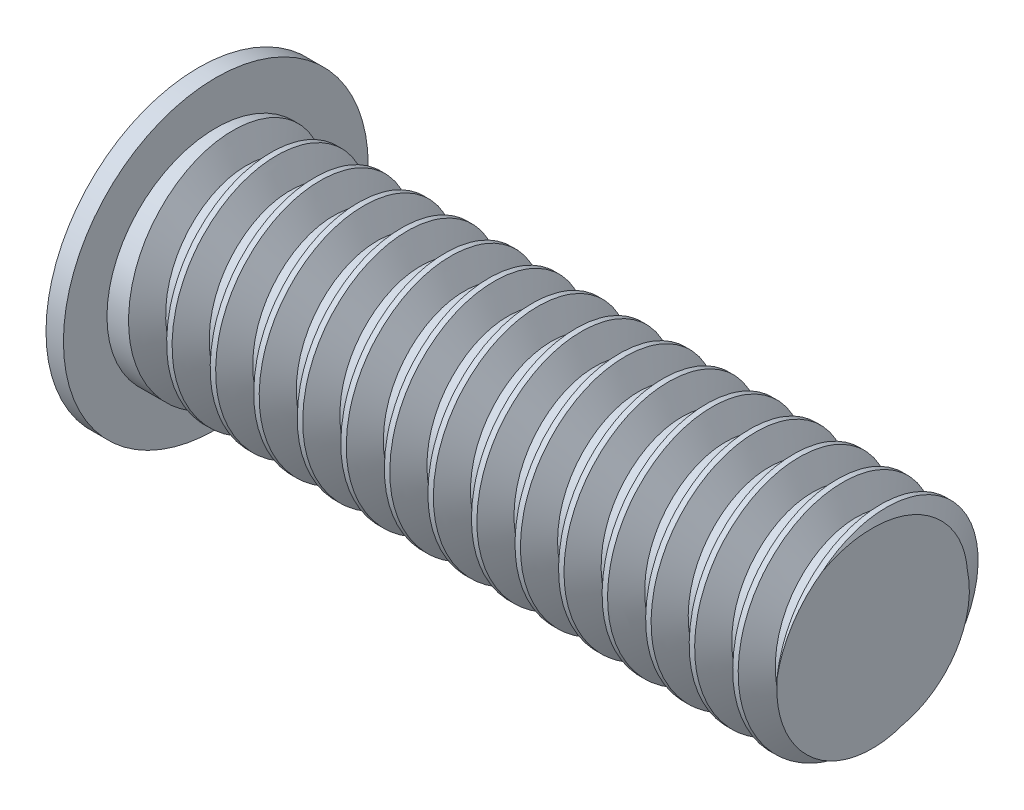
from build123d import *

# Parameters (mm, degrees)
SKETCH2_W          = 6.15375985
SKETCH2_H          = 0.730872065
CUT_EXTRUDE1_DEPTH = 0.254
THREAD1_PITCH      = 1.27


with BuildPart() as part:
    # Sketch1 → Revolve1 (revolve)
    with BuildSketch(Plane(origin=(0, 0, 0), x_dir=(1, 0, 0), z_dir=(0, 1, 0)), mode=Mode.PRIVATE) as revolve1_sk:
        Polygon((0, 0), (-19.490008539, 0), (-19.490008539, -1.27), (-19.998008539, -1.27), (-19.998008539, 3.175), (-19.490008539, 3.175), (0, 3.175), align=None)
    revolve(revolve1_sk.sketch.rotate(Axis((0, 0, -3.175), (-1, 0, 0)), 180), axis=Axis((0, 0, -3.175), (-1, 0, 0)))

    # Sketch2 → Cut-Extrude1 (cut)
    with BuildSketch(Plane.ZY.offset(19.998008539)):
        with Locations((-3.076879925, -0.012747769)):
            Rectangle(SKETCH2_W, SKETCH2_H)
    extrude(amount=-CUT_EXTRUDE1_DEPTH, mode=Mode.SUBTRACT)

    # Thread1: the profile of Thread Profile1 profile screwed along a right-hand helix of 15.874016 turns, 8 arcs to a turn; built about Z, then put on its axis
    thread1_z = Axis((0, 0, 0), (0, 0, 1))
    thread1_corners = [(3.1753, 0, -0.000173205), (3.1753, 0, 1.111423202), (2.487592339, 0, 0.714374999), (2.487592339, 0, 0.396874999)]
    with BuildLine(mode=Mode.PRIVATE) as thread1_profile:
        Line(thread1_corners[0], thread1_corners[1])
        Line(thread1_corners[1], thread1_corners[2])
        Line(thread1_corners[2], thread1_corners[3])
        Line(thread1_corners[3], thread1_corners[0])
    thread1_cap = Face(thread1_profile.wire())
    thread1_turn_angles = [0, 22.5, 45, 67.5, 90, 112.5, 135, 157.5, 180, 202.5, 225, 247.5, 270, 292.5, 315, 337.5, 360]
    thread1_turn_weights = [1, 0.9238795325112867, 1, 0.9238795325112867, 1, 0.9238795325112867, 1, 0.9238795325112867, 1, 0.9238795325112867, 1, 0.9238795325112867, 1, 0.9238795325112867, 1, 0.9238795325112867, 1]
    thread1_turn_rails = [Edge.make_bspline([Vector(p[0], p[1], 0).rotate(thread1_z, thread1_turn_angles[k]) / thread1_turn_weights[k] + Vector(0, 0, p[2] + THREAD1_PITCH * thread1_turn_angles[k] / 360) for k in range(17)], [0, 0, 0, 1, 1, 2, 2, 3, 3, 4, 4, 5, 5, 6, 6, 7, 7, 8, 8, 8], 2, thread1_turn_weights) for p in thread1_corners]
    thread1_turn_sides = [Face.make_surface_from_curves(thread1_turn_rails[p[0]], thread1_turn_rails[p[1]]) for p in [(0, 1), (1, 2), (2, 3), (3, 0)]]
    thread1_last_angles = [5400, 5422.5, 5445, 5467.5, 5490, 5512.5, 5535, 5557.5, 5580, 5602.5, 5625, 5647.5, 5670, 5692.322834646, 5714.645669291]
    thread1_last_weights = [1, 0.9238795325112867, 1, 0.9238795325112867, 1, 0.9238795325112867, 1, 0.9238795325112867, 1, 0.9238795325112867, 1, 0.9238795325112867, 1, 0.9250584165493089, 1]
    thread1_last_rails = [Edge.make_bspline([Vector(p[0], p[1], 0).rotate(thread1_z, thread1_last_angles[k]) / thread1_last_weights[k] + Vector(0, 0, p[2] + THREAD1_PITCH * thread1_last_angles[k] / 360) for k in range(15)], [0, 0, 0, 1, 1, 2, 2, 3, 3, 4, 4, 5, 5, 6, 6, 7, 7, 7], 2, thread1_last_weights) for p in thread1_corners]
    thread1_last_sides = [Face.make_surface_from_curves(thread1_last_rails[p[0]], thread1_last_rails[p[1]]) for p in [(0, 1), (1, 2), (2, 3), (3, 0)]]
    thread1 = Plane(origin=(-19.490008539, 0, -3.175), x_dir=(0, 0, -1), z_dir=(1, 0, 0)) * Solid(Shell([*[p.moved(Location((0, 0, THREAD1_PITCH * i))) for i in range(15) for p in thread1_turn_sides], *thread1_last_sides, thread1_cap, thread1_cap.rotate(thread1_z, 5714.645669291).moved(Location((0, 0, THREAD1_PITCH * 5714.645669291 / 360)))]))
    add(thread1, mode=Mode.SUBTRACT)


solid = part.part
